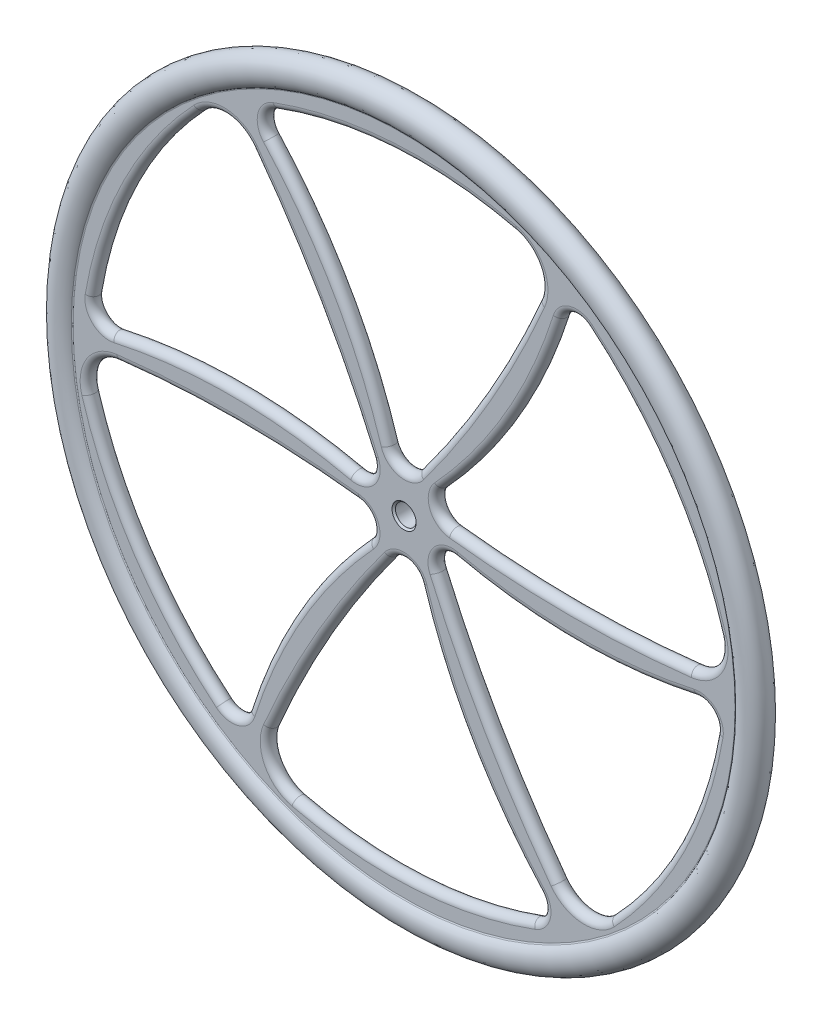
from build123d import *

# Parameters (mm, degrees)
CUT_EXTRUDE1_DEPTH       = 74.918206627
FILLET1_R                = 1
FILLET2_R                = 0.25
CHAMFER1_SIZE            = 0.25
CIRPATTERN2_COUNT        = 6
FILLET1_OF_CIRPATTERN2_R = 1


with BuildPart() as part:
    # Sketch1 → Revolve1 (revolve)
    with BuildSketch(Plane(origin=(0, 0, 0), x_dir=(1, 0, 0), z_dir=(0, 1, 0))):
        with BuildLine():
            Line((1.5, 3), (1.5, 0))
            Line((1.5, 0), (48.12806752, 0))
            add(Edge.make_bspline(
                [(48.12806752, 0), (52.225, -5.301910747), (52.225, 1), (52.225, 7.301910747), (48.12806752, 2)],
                knots=[0.571079469, 0.571079469, 0.571079469, 3.141592654, 3.141592654, 5.712105838, 5.712105838, 5.712105838], degree=2, weights=[1, 0.281675373, 1, 0.281675373, 1]))
            Line((48.12806752, 2), (2, 2))
            Line((2, 2), (2, 3))
            Line((2, 3), (1.5, 3))
        make_face()
    revolve(axis=Axis((0, 0, 0), (0, 0, -1)))

    # Sketch2 → Cut-Extrude1 (cut, through all)
    with BuildSketch(Plane.XY):
        with BuildLine():
            ThreePointArc((6.710628848, 1.516803605), (24.147667895, 0.50860594), (41.583693173, 1.534186645))
            ThreePointArc((41.583693173, 1.534186645), (45.178305917, 3.753773559), (45.789974782, 7.933925237))
            ThreePointArc((45.789974782, 7.933925237), (38.338622573, 23.850298643), (26.595205331, 36.924920765))
            ThreePointArc((26.595205331, 36.924920765), (24.295036919, 37.398546863), (22.616938803, 35.755658212))
            ThreePointArc((22.616938803, 35.755658212), (15.542096241, 19.765879602), (5.162393349, 5.695052151))
            ThreePointArc((5.162393349, 5.695052151), (4.655762624, 3.131350976), (6.710628848, 1.516803605))
        make_face()
    cut_extrude1 = extrude(amount=-CUT_EXTRUDE1_DEPTH, mode=Mode.SUBTRACT)

    # Fillet1
    fillet1_edges = [part.edges().sort_by_distance(p)[0] for p in [
        (24.147667895, 0.50860594, -2),
        (45.178305917, 3.753773559, -2),
        (38.338622573, 23.850298643, -2),
        (24.295036919, 37.398546863, -2),
        (15.542096241, 19.765879602, -2),
        (4.655762624, 3.131350976, -2),
        (6.710628848, 1.516803605, -1),
        (5.162393349, 5.695052151, -1),
        (22.616938803, 35.755658212, -1),
        (26.595205331, 36.924920765, -1),
        (45.789974782, 7.933925237, -1),
        (41.583693173, 1.534186645, -1),
        (4.655762624, 3.131350976, 0),
        (24.147667895, 0.50860594, 0),
        (45.178305917, 3.753773559, 0),
        (38.338622573, 23.850298643, 0),
        (24.295036919, 37.398546863, 0),
        (15.542096241, 19.765879602, 0),
    ]]
    fillet(fillet1_edges, radius=FILLET1_R - 0.0001)  # a hair under: the kernel refuses the full size

    # Fillet2
    fillet2_edges = [part.edges().sort_by_distance(p)[0] for p in [
        (-48.12806752, 0, 0),
    ]]
    fillet(fillet2_edges, radius=FILLET2_R)

    # Chamfer1
    chamfer1_edges = [part.edges().sort_by_distance(p)[0] for p in [
        (-1.5, 0, 0),
        (-1.5, 0, -3),
    ]]
    chamfer(chamfer1_edges, length=CHAMFER1_SIZE)

    # CirPattern2: Cut-Extrude1 ×6 about axis
    cirpattern2_axis = Axis((0, 0, 0), (0, 0, -1))
    for i in range(1, CIRPATTERN2_COUNT):
        add(cut_extrude1.rotate(cirpattern2_axis, i * 360 / CIRPATTERN2_COUNT), mode=Mode.SUBTRACT)

    # Fillet1 of CirPattern2
    fillet1_of_cirpattern2_edges = [part.edges().sort_by_distance(p)[0] for p in [
        (12.514299612, -20.658190869, -2),
        (25.84001622, -37.248673844, -2),
        (39.824275799, -21.277071773, -2),
        (44.535610107, -2.340845726, -2),
        (24.888801984, -3.576910372, -2),
        (5.039710806, -2.466333219, -2),
        (4.668904878, -5.053173255, -1),
        (7.513256513, -1.623237709, -1),
        (42.273777742, -1.709014454, -1),
        (45.275522081, -4.569663053, -1),
        (29.765968198, -35.688318782, -1),
        (22.120491195, -35.245441348, -1),
        (5.039710806, -2.466333219, 0),
        (12.514299612, -20.658190869, 0),
        (25.84001622, -37.248673844, 0),
        (39.824275799, -21.277071773, 0),
        (44.535610107, -2.340845726, 0),
        (24.888801984, -3.576910372, 0),
        (-11.633368283, -21.166796809, -2),
        (-19.338289696, -41.002447403, -2),
        (1.485653226, -45.127370416, -2),
        (20.240573189, -39.739392589, -2),
        (9.346705743, -23.342789974, -2),
        (0.383948181, -5.597684195, -2),
        (-2.041723969, -6.56997686, -1),
        (2.350863164, -7.31828986, -1),
        (19.656838939, -37.464672666, -1),
        (18.68031675, -41.494583818, -1),
        (-16.024006584, -43.622244019, -1),
        (-19.463201978, -36.779627993, -1),
        (0.383948181, -5.597684195, 0),
        (-11.633368283, -21.166796809, 0),
        (-19.338289696, -41.002447403, 0),
        (1.485653226, -45.127370416, 0),
        (20.240573189, -39.739392589, 0),
        (9.346705743, -23.342789974, 0),
        (-24.147667895, -0.50860594, -2),
        (-45.178305917, -3.753773559, -2),
        (-38.338622573, -23.850298643, -2),
        (-24.295036919, -37.398546863, -2),
        (-15.542096241, -19.765879602, -2),
        (-4.655762624, -3.131350976, -2),
        (-6.710628848, -1.516803605, -1),
        (-5.162393349, -5.695052151, -1),
        (-22.616938803, -35.755658212, -1),
        (-26.595205331, -36.924920765, -1),
        (-45.789974782, -7.933925237, -1),
        (-41.583693173, -1.534186645, -1),
        (-4.655762624, -3.131350976, 0),
        (-24.147667895, -0.50860594, 0),
        (-45.178305917, -3.753773559, 0),
        (-38.338622573, -23.850298643, 0),
        (-24.295036919, -37.398546863, 0),
        (-15.542096241, -19.765879602, 0),
        (-12.514299612, 20.658190869, -2),
        (-25.84001622, 37.248673844, -2),
        (-39.824275799, 21.277071773, -2),
        (-44.535610107, 2.340845726, -2),
        (-24.888801984, 3.576910372, -2),
        (-5.039710806, 2.466333219, -2),
        (-4.668904878, 5.053173255, -1),
        (-7.513256513, 1.623237709, -1),
        (-42.273777742, 1.709014454, -1),
        (-45.275522081, 4.569663053, -1),
        (-29.765968198, 35.688318782, -1),
        (-22.120491195, 35.245441348, -1),
        (-5.039710806, 2.466333219, 0),
        (-12.514299612, 20.658190869, 0),
        (-25.84001622, 37.248673844, 0),
        (-39.824275799, 21.277071773, 0),
        (-44.535610107, 2.340845726, 0),
        (-24.888801984, 3.576910372, 0),
        (11.633368283, 21.166796809, -2),
        (19.338289696, 41.002447403, -2),
        (-1.485653226, 45.127370416, -2),
        (-20.240573189, 39.739392589, -2),
        (-9.346705743, 23.342789974, -2),
        (-0.383948181, 5.597684195, -2),
        (2.041723969, 6.56997686, -1),
        (-2.350863164, 7.31828986, -1),
        (-19.656838939, 37.464672666, -1),
        (-18.68031675, 41.494583818, -1),
        (16.024006584, 43.622244019, -1),
        (19.463201978, 36.779627993, -1),
        (-0.383948181, 5.597684195, 0),
        (11.633368283, 21.166796809, 0),
        (19.338289696, 41.002447403, 0),
        (-1.485653226, 45.127370416, 0),
        (-20.240573189, 39.739392589, 0),
        (-9.346705743, 23.342789974, 0),
    ]]
    fillet(fillet1_of_cirpattern2_edges, radius=FILLET1_OF_CIRPATTERN2_R - 0.0001)  # a hair under: the kernel refuses the full size


solid = part.part
